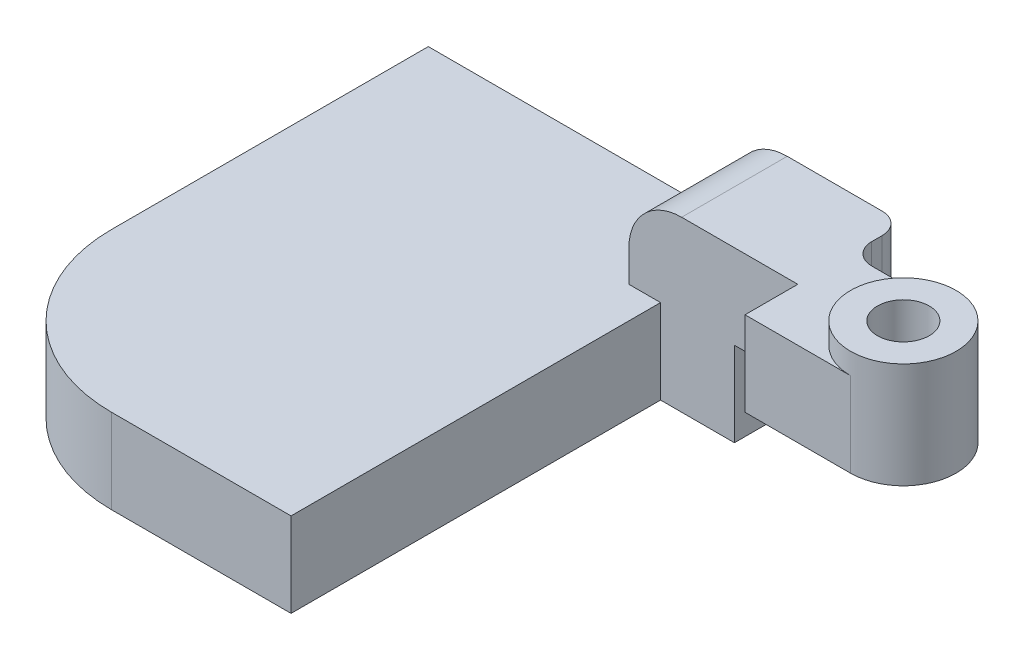
from build123d import *

# Parameters (mm, degrees)
EXTRUDE_1_DEPTH      = 8
FILLET_1_R           = 5
SKETCH_5_W           = 10
SKETCH_5_H           = 5
CUT_EXTRUDE_1_DEPTH  = 10
SKETCH_6_W           = 55
SKETCH_6_H           = 5
EXTRUDE_2_DEPTH      = 8
SKETCH_7_R           = 5
EXTRUDE_3_DEPTH      = 2
HOLE_WIZARD_1_D      = 4.9
HOLE_WIZARD_1_DEPTH  = 4
HOLE_WIZARD_2_D      = 3
HOLE_WIZARD_3_D      = 4.5
HOLE_WIZARD_3_DEPTH  = 2
SKETCH_16_W          = 45
SKETCH_16_H          = 10
CUT_EXTRUDE_4_DEPTH  = 82.018516402
SKETCH_17_W          = 45
SKETCH_17_H          = 45
EXTRUDE_4_DEPTH      = 16
SKETCH_20_W          = 45
SKETCH_20_H          = 45
CUT_EXTRUDE_5_DEPTH  = 8
SKETCH_21_W          = 10
SKETCH_21_H          = 16
EXTRUDE_6_DEPTH      = 10
SKETCH_23_W          = 55
SKETCH_23_H          = 45
CUT_EXTRUDE_6_DEPTH  = 8
SKETCH_24_W          = 35
SKETCH_24_H          = 8
CUT_EXTRUDE_7_DEPTH  = 3
FILLET_5_R           = 2
SKETCH_25_W          = 45
SKETCH_25_H          = 8
CUT_EXTRUDE_8_DEPTH  = 10
FILLET_6_R           = 15
SKETCH_27_W          = 6
SKETCH_27_H          = 10
CUT_EXTRUDE_10_DEPTH = 5
SKETCH_28_W          = 6
SKETCH_28_H          = 3
CUT_EXTRUDE_11_DEPTH = 76.663729752
SKETCH_29_W          = 10
SKETCH_29_H          = 8
EXTRUDE_7_DEPTH      = 6
FILLET_7_R           = 5


with BuildPart() as part:
    # 草图1 → 凸台-拉伸1 (new body)
    with BuildSketch(Plane(origin=(0, 0, 0), x_dir=(1, 0, 0), z_dir=(0, 1, 0))):
        Polygon((0, 0), (0, 10), (-70, 10), (-70, -40), (-25, -40), (-25, 0), align=None)
    extrude(amount=EXTRUDE_1_DEPTH)

    # 圆角1
    fillet_1_edges = [part.edges().sort_by_distance(p)[0] for p in [
        (0, 4, 0),
        (0, 4, -10),
    ]]
    fillet(fillet_1_edges, radius=FILLET_1_R - 0.0001)  # a hair under: the kernel refuses the full size

    # 草图5 → 切除-拉伸1 (cut)
    with BuildSketch(Plane(origin=(0, 8, 0), x_dir=(1, 0, 0), z_dir=(0, 1, 0))):
        with Locations((-20, 2.5)):
            Rectangle(SKETCH_5_W, SKETCH_5_H)
    extrude(amount=-CUT_EXTRUDE_1_DEPTH, mode=Mode.SUBTRACT)

    # 草图6 → 凸台-拉伸2 (add)
    with BuildSketch(Plane(origin=(0, 8, 0), x_dir=(1, 0, 0), z_dir=(0, 1, 0))):
        with Locations((-42.5, 12.5)):
            Rectangle(SKETCH_6_W, SKETCH_6_H)
    extrude(amount=-EXTRUDE_2_DEPTH)

    # 草图7 → 凸台-拉伸3 (add)
    with BuildSketch(Plane(origin=(0, 8, 0), x_dir=(1, 0, 0), z_dir=(0, 1, 0))):
        with Locations(Location((-5, 5, 0), (0, 0, 270))):
            Circle(SKETCH_7_R)
    extrude(amount=EXTRUDE_3_DEPTH)

    # 孔1
    with Locations(Plane(origin=(0, 10, 0), x_dir=(1, 0, 0), z_dir=(0, 1, 0))):
        with Locations((-5, 5)):
            Hole(HOLE_WIZARD_1_D / 2, depth=HOLE_WIZARD_1_DEPTH)

    # 孔2 (through all)
    with Locations(Plane(origin=(0, 0, 0), x_dir=(-1, 0, 0), z_dir=(0, -1, 0))):
        with Locations((5, 5)):
            Hole(HOLE_WIZARD_2_D / 2)

    # 孔3
    with Locations(Plane(origin=(0, 0, 0), x_dir=(-1, 0, 0), z_dir=(0, -1, 0))):
        with Locations((5, 5)):
            Hole(HOLE_WIZARD_3_D / 2, depth=HOLE_WIZARD_3_DEPTH)

    # 草图16 → 切除-拉伸4 (cut, through all)
    with BuildSketch(Plane(origin=(0, 8, 0), x_dir=(1, 0, 0), z_dir=(0, 1, 0))):
        with Locations((-47.5, -35)):
            Rectangle(SKETCH_16_W, SKETCH_16_H)
    extrude(amount=-CUT_EXTRUDE_4_DEPTH, mode=Mode.SUBTRACT)

    # 草图17 → 凸台-拉伸4 (add)
    with BuildSketch(Plane.XZ):
        with Locations((-47.5, 7.5)):
            Rectangle(SKETCH_17_W, SKETCH_17_H)
    extrude(amount=EXTRUDE_4_DEPTH)

    # 草图20 → 切除-拉伸5 (cut)
    with BuildSketch(Plane(origin=(0, 8, 0), x_dir=(1, 0, 0), z_dir=(0, 1, 0))):
        with Locations((-47.5, -7.5)):
            Rectangle(SKETCH_20_W, SKETCH_20_H)
    extrude(amount=-CUT_EXTRUDE_5_DEPTH, mode=Mode.SUBTRACT)


with BuildPart() as cut_extrude_5_piece_1:
    # of the separate pieces the step leaves, piece 1, a body of its own (cut_extrude_5_pieces)
    add(part.part.solids().sort_by_distance((-25, 0, 30))[0])



with BuildPart() as cut_extrude_5_piece_2:
    # of the separate pieces the step leaves, piece 2, a body of its own (cut_extrude_5_pieces)
    add(part.part.solids().sort_by_distance((0, 0, -4.9999))[0])


with BuildPart() as cut_extrude_5_piece_1_1:
    add(cut_extrude_5_piece_1.part)

    add(cut_extrude_5_piece_2.part)  # 凸台-拉伸6 merges 切除-拉伸5 piece 2
    # 草图21 → 凸台-拉伸6 (add)
    with BuildSketch(Plane(origin=(0, 0, -15), x_dir=(-1, 0, 0), z_dir=(0, 0, -1))):
        with Locations((20, -8)):
            Rectangle(SKETCH_21_W, SKETCH_21_H)
    extrude(amount=-EXTRUDE_6_DEPTH)

    # 草图23 → 切除-拉伸6 (cut)
    with BuildSketch(Plane.XZ.offset(16)):
        with Locations((-42.5, 7.5)):
            Rectangle(SKETCH_23_W, SKETCH_23_H)
    extrude(amount=-CUT_EXTRUDE_6_DEPTH, mode=Mode.SUBTRACT)

    # 草图24 → 切除-拉伸7 (cut)
    with BuildSketch(Plane(origin=(-25, 0, 0), x_dir=(0, 0, -1), z_dir=(1, 0, 0))):
        with Locations((-12.5, -4)):
            Rectangle(SKETCH_24_W, SKETCH_24_H)
    extrude(amount=-CUT_EXTRUDE_7_DEPTH, mode=Mode.SUBTRACT)

    # 圆角5
    fillet_5_edges = [cut_extrude_5_piece_1_1.edges().sort_by_distance(p)[0] for p in [
        (-15, 0, -15),
        (-15, 4, -10),
    ]]
    fillet(fillet_5_edges, radius=FILLET_5_R)

    # 草图25 → 切除-拉伸8 (cut)
    with BuildSketch(Plane.ZY.offset(70)):
        with Locations((7.5, -4)):
            Rectangle(SKETCH_25_W, SKETCH_25_H)
    extrude(amount=-CUT_EXTRUDE_8_DEPTH, mode=Mode.SUBTRACT)

    # 圆角6
    fillet_6_edges = [cut_extrude_5_piece_1_1.edges().sort_by_distance(p)[0] for p in [
        (-60, -4, 30),
    ]]
    fillet(fillet_6_edges, radius=FILLET_6_R)

    # 草图27 → 切除-拉伸10 (cut)
    with BuildSketch(Plane(origin=(0, -8, 0), x_dir=(-1, 0, 0), z_dir=(0, -1, 0))):
        with Locations((18, 10)):
            Rectangle(SKETCH_27_W, SKETCH_27_H)
    extrude(amount=-CUT_EXTRUDE_10_DEPTH, mode=Mode.SUBTRACT)

    # 草图28 → 切除-拉伸11 (cut, through all)
    with BuildSketch(Plane(origin=(0, 0, -15), x_dir=(-1, 0, 0), z_dir=(0, 0, -1))):
        with Locations((18, -1.5)):
            Rectangle(SKETCH_28_W, SKETCH_28_H)
    extrude(amount=-CUT_EXTRUDE_11_DEPTH, mode=Mode.SUBTRACT)

    # 草图29 → 凸台-拉伸7 (add)
    with BuildSketch(Plane.ZY.offset(25)):
        with Locations((-10, 4)):
            Rectangle(SKETCH_29_W, SKETCH_29_H)
    extrude(amount=EXTRUDE_7_DEPTH)

    # 圆角7
    fillet_7_edges = [cut_extrude_5_piece_1_1.edges().sort_by_distance(p)[0] for p in [
        (-31, 8, -10),
    ]]
    fillet(fillet_7_edges, radius=FILLET_7_R)


solid = cut_extrude_5_piece_1_1.part
